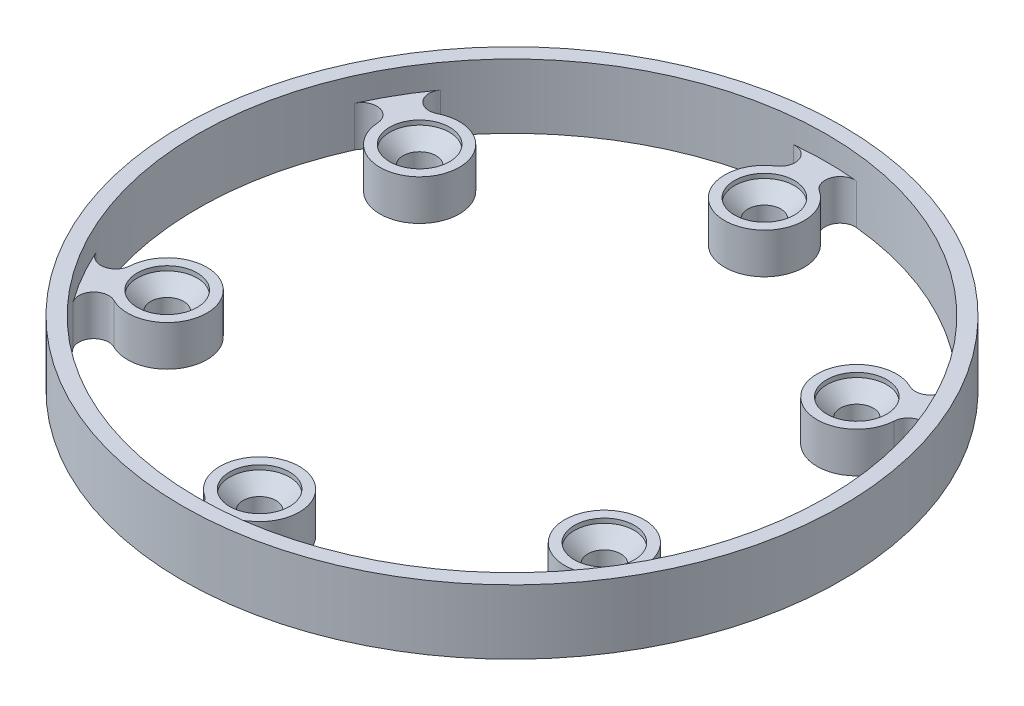
from build123d import *

# Parameters (mm, degrees)
SKETCH1_R                        = 22
BASE_SHAPE_DEPTH                 = 4.3
BASE_CUT_REACH                   = 33.408
SKETCH4_R                        = 2
MILLING_FILLETS_R                = 1
REMOVE_INNER_2_REACH             = 33.408
SKETCH11_R                       = 21
CUT_EXTRUDE2_DEPTH               = 1.6
OUTER_M2_COUNTERSUNKS_AT_2_COUNT = 2
OUTER_M2_COUNTERSUNKS_AT_2_PITCH = 16.85
OUTER_M2_COUNTERSUNKS_AT_3_COUNT = 2
OUTER_M2_COUNTERSUNKS_AT_3_PITCH = 29.185056108
OUTER_M2_COUNTERSUNKS_AT_4_COUNT = 2
OUTER_M2_COUNTERSUNKS_AT_4_PITCH = 33.7
OUTER_M2_COUNTERSUNKS_AT_5_COUNT = 2
OUTER_M2_COUNTERSUNKS_AT_5_PITCH = 29.185056108
OUTER_M2_COUNTERSUNKS_AT_6_COUNT = 2
OUTER_M2_COUNTERSUNKS_AT_6_PITCH = 16.85


with BuildPart() as part:
    # Sketch1 → Base shape (new body)
    with BuildSketch(Plane(origin=(0, 0, 0), x_dir=(1, 0, 0), z_dir=(0, 1, 0))):
        Circle(SKETCH1_R)
    extrude(amount=BASE_SHAPE_DEPTH)

    # Sketch4 → Base cut (cut, up to next)
    with BuildSketch(Plane(origin=(0, 4.3, 0), x_dir=(1, 0, 0), z_dir=(0, 1, 0)), mode=Mode.PRIVATE) as base_cut_sk1:
        with BuildLine():
            Line((-0.5, 4.623040125), (-0.5, 14.247597264))
            ThreePointArc((-0.5, 14.247597264), (-2.599217903, 16.333699419), (-1.456663106, 19.063737246))
            ThreePointArc((-1.456663106, 19.063737246), (-1.064005646, 20.23376217), (-2.106664753, 20.894065273))
            ThreePointArc((-2.106664753, 20.894065273), (-10.500000081, 18.186533433), (-17.041459047, 12.271457678))
            ThreePointArc((-17.041459047, 12.271457678), (-16.990949169, 11.038336932), (-15.781349192, 10.793375879))
            ThreePointArc((-15.781349192, 10.793375879), (-12.845789682, 10.417838443), (-12.088781174, 7.556811334))
            Line((-12.088781174, 7.556811334), (-3.753670191, 2.744532765))
            ThreePointArc((-3.753670191, 2.744532765), (-2.325, 4.027018128), (-0.5, 4.623040125))
        make_face()
    base_cut_tool1 = extrude(base_cut_sk1.sketch, amount=-BASE_CUT_REACH, mode=Mode.PRIVATE) & part.part
    # Sketch4 → Base cut (cut, up to next)
    with BuildSketch(Plane(origin=(0, 4.3, 0), x_dir=(1, 0, 0), z_dir=(0, 1, 0)), mode=Mode.PRIVATE) as base_cut_sk2:
        with BuildLine():
            Line((0.5, 14.247597264), (0.5, 4.623040125))
            ThreePointArc((0.5, 4.623040125), (2.325, 4.027018128), (3.753670191, 2.744532765))
            Line((3.753670191, 2.744532765), (12.088781174, 7.556811334))
            ThreePointArc((12.088781174, 7.556811334), (12.845789714, 10.417838471), (15.781349267, 10.793375841))
            ThreePointArc((15.781349267, 10.793375841), (16.990949176, 11.03833694), (17.041459084, 12.271457627))
            ThreePointArc((17.041459084, 12.271457627), (10.500000121, 18.186533409), (2.106664783, 20.89406527))
            ThreePointArc((2.106664783, 20.89406527), (1.064005647, 20.233762173), (1.456663125, 19.063737234))
            ThreePointArc((1.456663125, 19.063737234), (2.599217901, 16.333699407), (0.5, 14.247597264))
        make_face()
    base_cut_tool2 = extrude(base_cut_sk2.sketch, amount=-BASE_CUT_REACH, mode=Mode.PRIVATE) & part.part
    # Sketch4 → Base cut (cut, up to next)
    with BuildSketch(Plane(origin=(0, 4.3, 0), x_dir=(1, 0, 0), z_dir=(0, 1, 0)), mode=Mode.PRIVATE) as base_cut_sk3:
        with BuildLine():
            ThreePointArc((-4.253670191, -1.878507361), (-4.65, 0), (-4.253670191, 1.878507361))
            Line((-4.253670191, 1.878507361), (-12.588781174, 6.69078593))
            ThreePointArc((-12.588781174, 6.69078593), (-15.445007591, 5.915860977), (-17.2380123, 8.27036138))
            ThreePointArc((-17.2380123, 8.27036138), (-18.054954849, 9.19542516), (-19.148123664, 8.622607504))
            ThreePointArc((-19.148123664, 8.622607504), (-21, 0), (-19.148123664, -8.622607504))
            ThreePointArc((-19.148123664, -8.622607504), (-18.054954849, -9.19542516), (-17.2380123, -8.27036138))
            ThreePointArc((-17.2380123, -8.27036138), (-15.445007591, -5.915860977), (-12.588781174, -6.69078593))
            Line((-12.588781174, -6.69078593), (-4.253670191, -1.878507361))
        make_face()
    base_cut_tool3 = extrude(base_cut_sk3.sketch, amount=-BASE_CUT_REACH, mode=Mode.PRIVATE) & part.part
    # Sketch4 → Base cut (cut, up to next)
    with BuildSketch(Plane(origin=(0, 4.3, 0), x_dir=(1, 0, 0), z_dir=(0, 1, 0)), mode=Mode.PRIVATE) as base_cut_sk4:
        with BuildLine():
            Line((12.588781174, 6.69078593), (4.253670191, 1.878507361))
            ThreePointArc((4.253670191, 1.878507361), (4.65, 0), (4.253670191, -1.878507361))
            Line((4.253670191, -1.878507361), (12.588781174, -6.69078593))
            ThreePointArc((12.588781174, -6.69078593), (15.44500764, -5.915860993), (17.238012306, -8.270361482))
            ThreePointArc((17.238012306, -8.270361482), (18.054954899, -9.19542517), (19.148123664, -8.622607504))
            ThreePointArc((19.148123664, -8.622607504), (21, -5.9e-08), (19.148123712, 8.622607396))
            ThreePointArc((19.148123712, 8.622607396), (18.054954907, 9.195425171), (17.2380123, 8.27036138))
            ThreePointArc((17.2380123, 8.27036138), (15.445007591, 5.915860977), (12.588781174, 6.69078593))
        make_face()
    base_cut_tool4 = extrude(base_cut_sk4.sketch, amount=-BASE_CUT_REACH, mode=Mode.PRIVATE) & part.part
    # Sketch4 → Base cut (cut, up to next)
    with BuildSketch(Plane(origin=(0, 4.3, 0), x_dir=(1, 0, 0), z_dir=(0, 1, 0)), mode=Mode.PRIVATE) as base_cut_sk5:
        with BuildLine():
            ThreePointArc((-0.5, -4.623040125), (-2.325, -4.027018128), (-3.753670191, -2.744532765))
            Line((-3.753670191, -2.744532765), (-12.088781174, -7.556811334))
            ThreePointArc((-12.088781174, -7.556811334), (-12.845789662, -10.417838426), (-15.781349145, -10.793375902))
            ThreePointArc((-15.781349145, -10.793375902), (-16.99094917, -11.038336934), (-17.041459014, -12.271457724))
            ThreePointArc((-17.041459014, -12.271457724), (-10.500000007, -18.186533475), (-2.10666464, -20.894065284))
            ThreePointArc((-2.10666464, -20.894065284), (-1.064005631, -20.233762127), (-1.456663086, -19.063737259))
            ThreePointArc((-1.456663086, -19.063737259), (-2.599217906, -16.33369943), (-0.5, -14.247597264))
            Line((-0.5, -14.247597264), (-0.5, -4.623040125))
        make_face()
    base_cut_tool5 = extrude(base_cut_sk5.sketch, amount=-BASE_CUT_REACH, mode=Mode.PRIVATE) & part.part
    # Sketch4 → Base cut (cut, up to next)
    with BuildSketch(Plane(origin=(0, 4.3, 0), x_dir=(1, 0, 0), z_dir=(0, 1, 0)), mode=Mode.PRIVATE) as base_cut_sk6:
        with BuildLine():
            Line((12.088781174, -7.556811334), (3.753670191, -2.744532765))
            ThreePointArc((3.753670191, -2.744532765), (2.325, -4.027018128), (0.5, -4.623040125))
            Line((0.5, -4.623040125), (0.5, -14.247597264))
            ThreePointArc((0.5, -14.247597264), (2.599217906, -16.33369943), (1.456663086, -19.063737259))
            ThreePointArc((1.456663086, -19.063737259), (1.064005629, -20.23376212), (2.106664626, -20.894065285))
            ThreePointArc((2.106664626, -20.894065285), (10.500000013, -18.186533472), (17.04145903, -12.271457701))
            ThreePointArc((17.04145903, -12.271457701), (16.990949199, -11.038336967), (15.781349249, -10.79337585))
            ThreePointArc((15.781349249, -10.79337585), (12.845789706, -10.417838464), (12.088781174, -7.556811334))
        make_face()
    base_cut_tool6 = extrude(base_cut_sk6.sketch, amount=-BASE_CUT_REACH, mode=Mode.PRIVATE) & part.part
    # Sketch4 → Base cut (cut, up to next)
    with BuildSketch(Plane(origin=(0, 4.3, 0), x_dir=(1, 0, 0), z_dir=(0, 1, 0)), mode=Mode.PRIVATE) as base_cut_sk7:
        Circle(SKETCH4_R)
    base_cut_tool7 = extrude(base_cut_sk7.sketch, amount=-BASE_CUT_REACH, mode=Mode.PRIVATE) & part.part
    add(base_cut_tool1.solids().sort_by_distance((-6.983603, 4.3, -12.095955))[0], mode=Mode.SUBTRACT)
    add(base_cut_tool2.solids().sort_by_distance((6.983603, 4.3, -12.095955))[0], mode=Mode.SUBTRACT)
    add(base_cut_tool3.solids().sort_by_distance((-13.967206, 4.3, 0))[0], mode=Mode.SUBTRACT)
    add(base_cut_tool4.solids().sort_by_distance((13.967206, 4.3, 0))[0], mode=Mode.SUBTRACT)
    add(base_cut_tool5.solids().sort_by_distance((-6.983603, 4.3, 12.095955))[0], mode=Mode.SUBTRACT)
    add(base_cut_tool6.solids().sort_by_distance((6.983603, 4.3, 12.095955))[0], mode=Mode.SUBTRACT)
    add(base_cut_tool7.solids().sort_by_distance((0, 4.3, 0))[0], mode=Mode.SUBTRACT)

    # Milling fillets
    milling_fillets_edges = [part.edges().sort_by_distance(p)[0] for p in [
        (12.088781174, 2.15, 7.556811334),
        (0.5, 2.15, 4.623040125),
        (12.588781174, 2.15, -6.69078593),
        (-0.5, 2.15, -4.623040125),
        (12.088781174, 2.15, -7.556811334),
        (0.5, 2.15, -4.623040125),
        (4.253670191, 2.15, 1.878507361),
        (0.5, 2.15, -14.247597264),
        (-12.088781174, 2.15, 7.556811334),
        (0.5, 2.15, 14.247597264),
        (3.753670191, 2.15, 2.744532765),
        (-0.5, 2.15, 4.623040125),
        (-0.5, 2.15, -14.247597264),
        (-0.5, 2.15, 14.247597264),
        (12.588781174, 2.15, 6.69078593),
        (3.753670191, 2.15, -2.744532765),
        (-4.253670191, 2.15, 1.878507361),
        (-12.588781174, 2.15, 6.69078593),
        (-3.753670191, 2.15, -2.744532765),
        (-12.088781174, 2.15, -7.556811334),
        (-12.588781174, 2.15, -6.69078593),
        (-4.253670191, 2.15, -1.878507361),
        (4.253670191, 2.15, -1.878507361),
        (-3.753670191, 2.15, 2.744532765),
    ]]
    fillet(milling_fillets_edges, radius=MILLING_FILLETS_R)

    # Sketch10 → Remove inner 2 (cut, up to next)
    with BuildSketch(Plane(origin=(0, 4.3, 0), x_dir=(1, 0, 0), z_dir=(0, 1, 0)), mode=Mode.PRIVATE) as remove_inner_2_sk1:
        with BuildLine():
            ThreePointArc((15.732960366, -6.032947714), (16.568386798, -3.067744923), (16.85, 0))
            ThreePointArc((16.85, 0), (16.568386798, 3.067744923), (15.732960366, 6.032947714))
            ThreePointArc((15.732960366, 6.032947714), (12.297560734, 7.1), (13.091166163, 10.608669497))
            ThreePointArc((13.091166163, 10.608669497), (8.425, 14.592528054), (2.641794203, 16.641617211))
            ThreePointArc((2.641794203, 16.641617211), (0, 14.2), (-2.641794203, 16.641617211))
            ThreePointArc((-2.641794203, 16.641617211), (-8.425, 14.592528054), (-13.091166163, 10.608669497))
            ThreePointArc((-13.091166163, 10.608669497), (-12.247201956, 9.65867155), (-11.942528054, 8.425))
            ThreePointArc((-11.942528054, 8.425), (-13.178251848, 6.183946048), (-15.732960366, 6.032947714))
            ThreePointArc((-15.732960366, 6.032947714), (-16.85, 0), (-15.732960366, -6.032947714))
            ThreePointArc((-15.732960366, -6.032947714), (-13.178251848, -6.183946048), (-11.942528054, -8.425))
            ThreePointArc((-11.942528054, -8.425), (-12.247201956, -9.65867155), (-13.091166163, -10.608669497))
            ThreePointArc((-13.091166163, -10.608669497), (-8.425, -14.592528054), (-2.641794203, -16.641617211))
            ThreePointArc((-2.641794203, -16.641617211), (0, -14.2), (2.641794203, -16.641617211))
            ThreePointArc((2.641794203, -16.641617211), (8.425, -14.592528054), (13.091166163, -10.608669497))
            ThreePointArc((13.091166163, -10.608669497), (12.297560734, -7.1), (15.732960366, -6.032947714))
        make_face()
    remove_inner_2_tool1 = extrude(remove_inner_2_sk1.sketch, amount=-REMOVE_INNER_2_REACH, mode=Mode.PRIVATE) & part.part
    add(remove_inner_2_tool1.solids().sort_by_distance((0, 4.3, 0))[0], mode=Mode.SUBTRACT)

    # Sketch11 → Cut-Extrude2 (cut)
    with BuildSketch(Plane(origin=(0, 4.3, 0), x_dir=(1, 0, 0), z_dir=(0, 1, 0))):
        Circle(SKETCH11_R)
    extrude(amount=-CUT_EXTRUDE2_DEPTH, mode=Mode.SUBTRACT)

    # Sketch8 → Outer M2 countersunks (revolve, cut)
    with BuildSketch(Plane(origin=(-14.592528054, 2.7, -8.425), x_dir=(0, 0, 1), z_dir=(1, 0, 0))):
        Polygon((0, 0), (0, 2.7), (1.1, 2.7), (1.1, 1.2), (2, 0.3), (2, 0), align=None)
    outer_m2_countersunks = revolve(axis=Axis((-14.592528054, 9.05, -8.425), (0, -1, 0)), mode=Mode.SUBTRACT)

    # Outer M2 countersunks at 2: Outer M2 countersunks ×2
    with Locations(*[Vector(0.8660254037844385, 0, -0.5000000000000003) * (i * OUTER_M2_COUNTERSUNKS_AT_2_PITCH) for i in range(1, OUTER_M2_COUNTERSUNKS_AT_2_COUNT)]):
        add(outer_m2_countersunks, mode=Mode.SUBTRACT)

    # Outer M2 countersunks at 3: Outer M2 countersunks ×2
    with Locations(*[(i * OUTER_M2_COUNTERSUNKS_AT_3_PITCH, 0, 0) for i in range(1, OUTER_M2_COUNTERSUNKS_AT_3_COUNT)]):
        add(outer_m2_countersunks, mode=Mode.SUBTRACT)

    # Outer M2 countersunks at 4: Outer M2 countersunks ×2
    with Locations(*[Vector(0.8660254037844389, 0, 0.4999999999999995) * (i * OUTER_M2_COUNTERSUNKS_AT_4_PITCH) for i in range(1, OUTER_M2_COUNTERSUNKS_AT_4_COUNT)]):
        add(outer_m2_countersunks, mode=Mode.SUBTRACT)

    # Outer M2 countersunks at 5: Outer M2 countersunks ×2
    with Locations(*[Vector(0.5000000000000004, 0, 0.8660254037844385) * (i * OUTER_M2_COUNTERSUNKS_AT_5_PITCH) for i in range(1, OUTER_M2_COUNTERSUNKS_AT_5_COUNT)]):
        add(outer_m2_countersunks, mode=Mode.SUBTRACT)

    # Outer M2 countersunks at 6: Outer M2 countersunks ×2
    with Locations(*[(0, 0, i * OUTER_M2_COUNTERSUNKS_AT_6_PITCH) for i in range(1, OUTER_M2_COUNTERSUNKS_AT_6_COUNT)]):
        add(outer_m2_countersunks, mode=Mode.SUBTRACT)


solid = part.part
